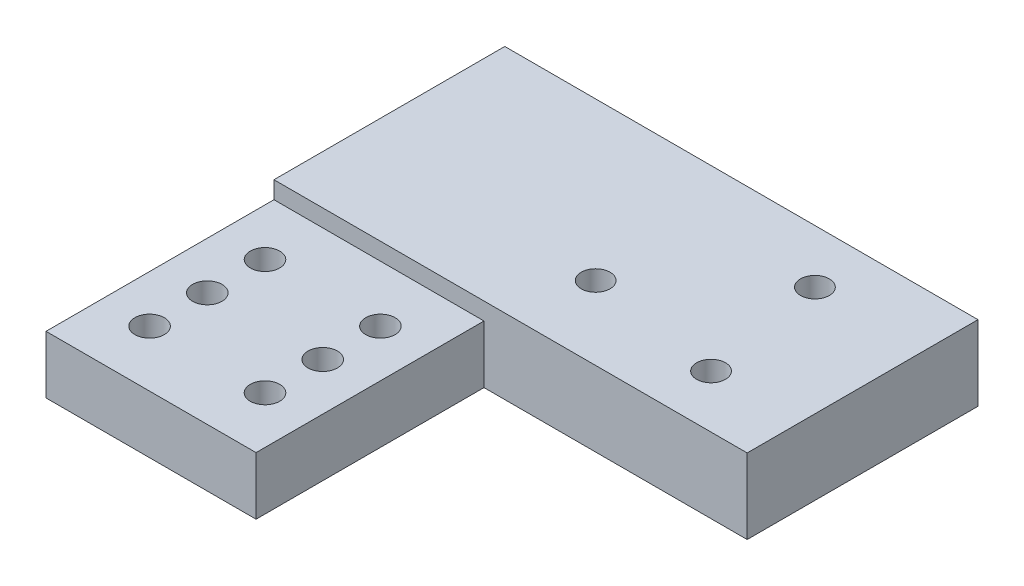
from build123d import *

# Parameters (mm, degrees)
SKETCH1_W                = 36.4
SKETCH1_H                = 39.5
SKETCH1_R                = 2.55
BOSS_EXTRUDE1_DEPTH      = 10
BOSS_EXTRUDE2_DEPTH      = 3
BOSS_EXTRUDE2_DEPTH_BACK = 10
SKETCH2_W                = 82
SKETCH2_H                = 40
F_5_0MM_DOWEL_HOLE1_D    = 5


with BuildPart() as part:
    # Sketch1 → Boss-Extrude1 (new body)
    with BuildSketch(Plane(origin=(0, 0, 0), x_dir=(1, 0, 0), z_dir=(0, 1, 0))):
        with Locations((18.2, 19.75)):
            Rectangle(SKETCH1_W, SKETCH1_H)
        with Locations((8.2, 29.75)):
            Circle(SKETCH1_R, mode=Mode.SUBTRACT)
        with Locations((28.2, 29.75)):
            Circle(SKETCH1_R, mode=Mode.SUBTRACT)
        with Locations((28.2, 19.75)):
            Circle(SKETCH1_R, mode=Mode.SUBTRACT)
        with Locations((28.2, 9.75)):
            Circle(SKETCH1_R, mode=Mode.SUBTRACT)
        with Locations((8.2, 19.75)):
            Circle(SKETCH1_R, mode=Mode.SUBTRACT)
        with Locations((8.2, 9.75)):
            Circle(SKETCH1_R, mode=Mode.SUBTRACT)
    extrude(amount=BOSS_EXTRUDE1_DEPTH)

    # Sketch2 → Boss-Extrude2 (add, two sides: drawn at the far end of the back side and taken through both)
    with BuildSketch(Plane(origin=(0, 10, 0), x_dir=(1, 0, 0), z_dir=(0, 1, 0)).offset(-BOSS_EXTRUDE2_DEPTH_BACK)):
        with Locations((41, 59.5)):
            Rectangle(SKETCH2_W, SKETCH2_H)
    extrude(amount=BOSS_EXTRUDE2_DEPTH + BOSS_EXTRUDE2_DEPTH_BACK)

    # Ø5.0mm Dowel Hole1 (through all)
    with Locations(Plane(origin=(42.996100309, 13, -52.245667008), x_dir=(0, 0, 1), z_dir=(0, 1, 0))):
        with Locations((0, 0), (-18, 20), (3.585786438, 23.585786437)):
            Hole(F_5_0MM_DOWEL_HOLE1_D / 2)


solid = part.part
